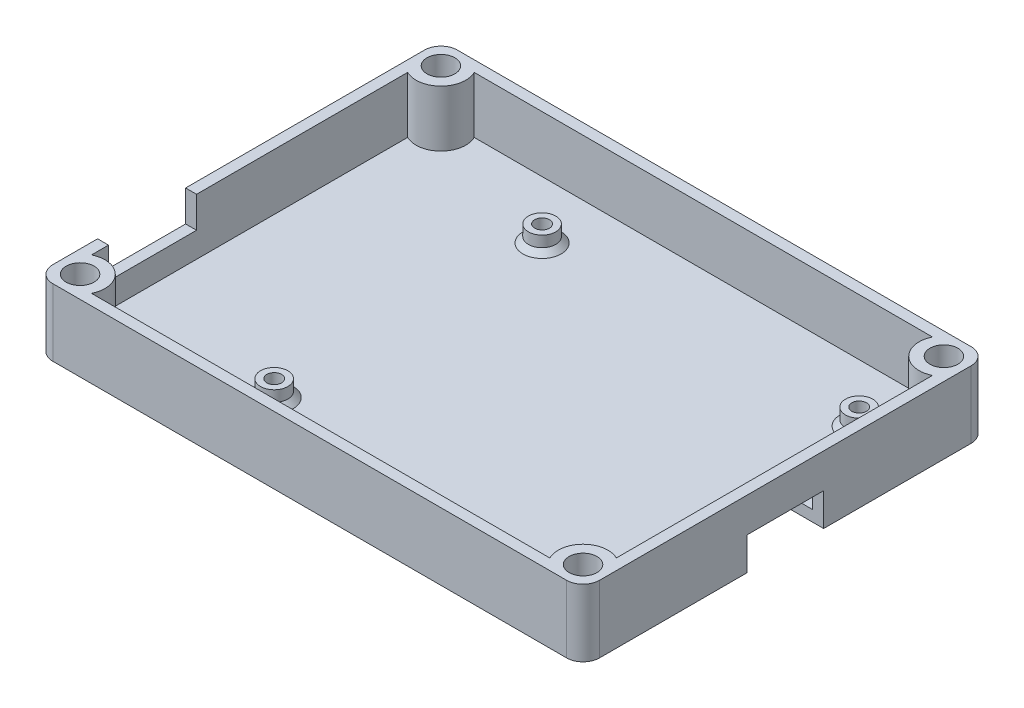
from build123d import *

# Parameters (mm, degrees)
SKETCH1_W                                            = 100
SKETCH1_H                                            = 74
SKETCH1_R                                            = 2.5527
BOSS_EXTRUDE1_DEPTH                                  = 12.3
SHELL1_T                                             = -2
SKETCH2_R                                            = 2.5
SKETCH2_R_2                                          = 1.35
BOSS_EXTRUDE2_DEPTH                                  = 3
CSK_FOR_M2_5_COUNTERSUNK_FLAT_HEAD_SCREW_D           = 2.7
CSK_FOR_M2_5_COUNTERSUNK_FLAT_HEAD_SCREW_CSINK_D     = 5.5
CSK_FOR_M2_5_COUNTERSUNK_FLAT_HEAD_SCREW_CSINK_ANGLE = 90
SKETCH11_W                                           = 16.1
SKETCH11_H                                           = 13.5
CUT_EXTRUDE1_DEPTH                                   = 3
FILLET1_R                                            = 3
SKETCH16_W                                           = 10.5
SKETCH16_H                                           = 14
CUT_EXTRUDE3_DEPTH                                   = 6
CHAMFER1_SIZE                                        = 1


with BuildPart() as part:
    # Sketch1 → Boss-Extrude1 (new body)
    with BuildSketch(Plane(origin=(0, 0, 0), x_dir=(1, 0, 0), z_dir=(0, 1, 0))):
        Rectangle(SKETCH1_W, SKETCH1_H)
        with Locations((46, -33)):
            Circle(SKETCH1_R, mode=Mode.SUBTRACT)
        with Locations((-46, -33)):
            Circle(SKETCH1_R, mode=Mode.SUBTRACT)
        with Locations((-46, 33)):
            Circle(SKETCH1_R, mode=Mode.SUBTRACT)
        with Locations((46, 33)):
            Circle(SKETCH1_R, mode=Mode.SUBTRACT)
    extrude(amount=BOSS_EXTRUDE1_DEPTH)

    # Shell1
    shell1_openings = [part.faces().sort_by_distance(p)[0] for p in [
        (0, 12.3, 0),
    ]]
    offset(amount=SHELL1_T, openings=shell1_openings)

    # Sketch2 → Boss-Extrude2 (add)
    # profile 1 of 4: a face of its own
    with BuildSketch(Plane(origin=(0, 2, 0), x_dir=(1, 0, 0), z_dir=(0, 1, 0))):
        with Locations((-19, 24.5)):
            Circle(SKETCH2_R)
        with Locations((-19, 24.5)):
            Circle(SKETCH2_R_2, mode=Mode.SUBTRACT)
    # profile 2 of 4: a face of its own
    with BuildSketch(Plane(origin=(0, 2, 0), x_dir=(1, 0, 0), z_dir=(0, 1, 0))):
        with Locations((39, 24.5)):
            Circle(SKETCH2_R)
        with Locations((39, 24.5)):
            Circle(SKETCH2_R_2, mode=Mode.SUBTRACT)
    # profile 3 of 4: a face of its own
    with BuildSketch(Plane(origin=(0, 2, 0), x_dir=(1, 0, 0), z_dir=(0, 1, 0))):
        with Locations((-19, -24.5)):
            Circle(SKETCH2_R)
        with Locations((-19, -24.5)):
            Circle(SKETCH2_R_2, mode=Mode.SUBTRACT)
    # profile 4 of 4: a face of its own
    with BuildSketch(Plane(origin=(0, 2, 0), x_dir=(1, 0, 0), z_dir=(0, 1, 0))):
        with Locations((39, -24.5)):
            Circle(SKETCH2_R)
        with Locations((39, -24.5)):
            Circle(SKETCH2_R_2, mode=Mode.SUBTRACT)
    extrude(amount=BOSS_EXTRUDE2_DEPTH)

    # CSK for M2.5 Countersunk Flat Head Screw1 (through all)
    with Locations(Plane(origin=(0, 0, 0), x_dir=(-1, 0, 0), z_dir=(0, -1, 0))):
        with Locations((19, -24.5), (19, 24.5), (-39, 24.5), (-39, -24.5)):
            CounterSinkHole(CSK_FOR_M2_5_COUNTERSUNK_FLAT_HEAD_SCREW_D / 2, CSK_FOR_M2_5_COUNTERSUNK_FLAT_HEAD_SCREW_CSINK_D / 2, counter_sink_angle=CSK_FOR_M2_5_COUNTERSUNK_FLAT_HEAD_SCREW_CSINK_ANGLE)

    # Sketch11 → Cut-Extrude1 (cut)
    with BuildSketch(Plane.ZY.offset(50)):
        with Locations((17.75, 13.35)):
            Rectangle(SKETCH11_W, SKETCH11_H)
    extrude(amount=-CUT_EXTRUDE1_DEPTH, mode=Mode.SUBTRACT)

    # Fillet1
    fillet1_edges = [part.edges().sort_by_distance(p)[0] for p in [
        (50, 6.15, 37),
        (-50, 6.15, 37),
        (-50, 6.15, -37),
        (50, 6.15, -37),
    ]]
    fillet(fillet1_edges, radius=FILLET1_R)

    # Sketch16 → Cut-Extrude3 (cut)
    with BuildSketch(Plane.XZ):
        with Locations((44.75, 0)):
            Rectangle(SKETCH16_W, SKETCH16_H)
    extrude(amount=-CUT_EXTRUDE3_DEPTH, mode=Mode.SUBTRACT)

    # Chamfer1
    chamfer1_edges = [part.edges().sort_by_distance(p)[0] for p in [
        (36.5, 2, 24.5),
        (36.5, 2, -24.5),
        (-21.5, 2, -24.5),
        (-21.5, 2, 24.5),
    ]]
    chamfer(chamfer1_edges, length=CHAMFER1_SIZE)


solid = part.part
